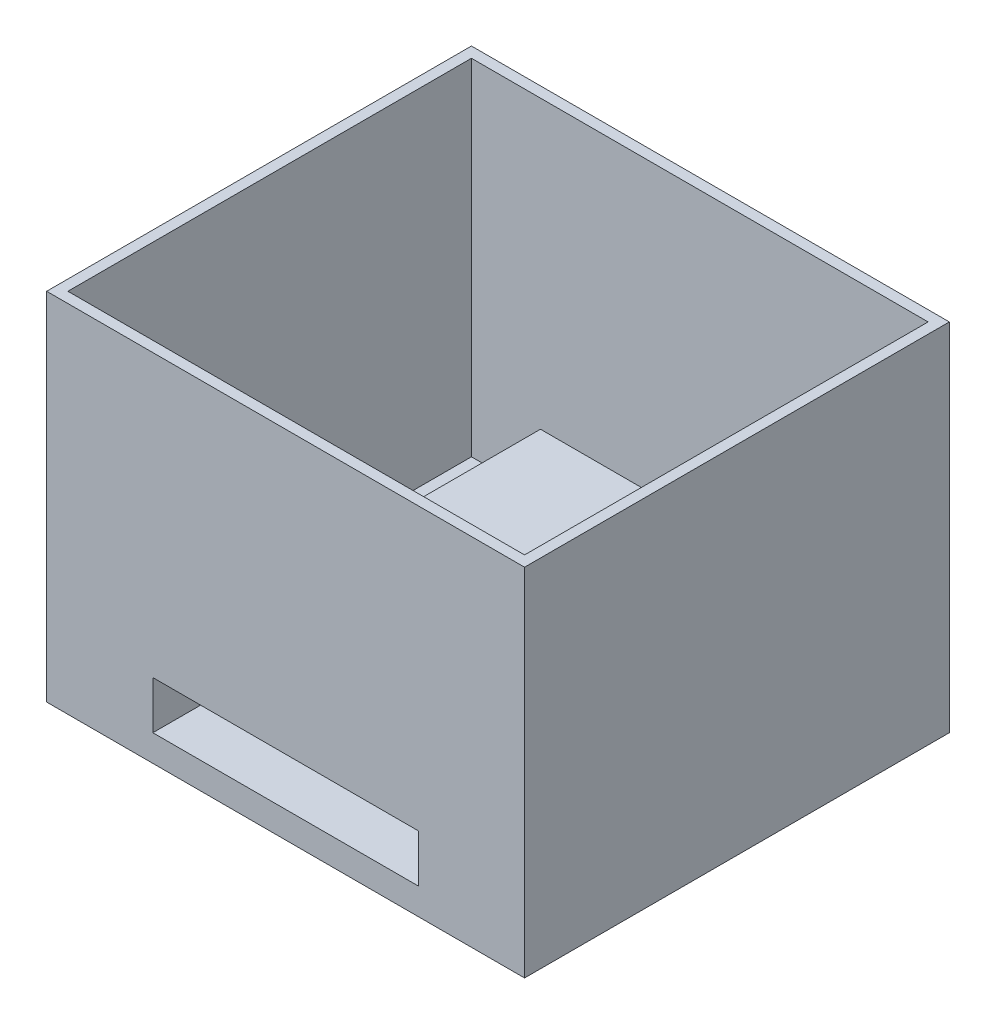
from build123d import *

# Parameters (mm, degrees)
SKETCH1_W           = 90
SKETCH1_H           = 67
BOSS_EXTRUDE1_DEPTH = 40
SHELL1_T            = -2
SKETCH2_W           = 50
SKETCH2_H           = 13
CUT_EXTRUDE4_DEPTH  = 40
SKETCH4_W           = 54
SKETCH4_H           = 13
BOSS_EXTRUDE2_DEPTH = 75
SHELL2_START        = 11.213016769
SHELL2_OUTLINE_W    = 9
SHELL2_OUTLINE_H    = 73
SHELL2_DEPTH        = 50


# Read off the part's stored shape, not the designer's step: Shell2
with BuildPart() as part:
    # Sketch1 → Boss-Extrude1 (new, symmetric)
    with BuildSketch(Plane.XY.offset(58.585622103)):
        with Locations((36.213016769, 11.266964079)):
            Rectangle(SKETCH1_W, SKETCH1_H)
    extrude(amount=BOSS_EXTRUDE1_DEPTH, both=True)

    # Shell1
    shell1_openings = [part.faces().sort_by_distance(p)[0] for p in [
        (36.213016769, 44.766964079, 58.585622103),
    ]]
    offset(amount=SHELL1_T, openings=shell1_openings, kind=Kind.INTERSECTION)

    # Sketch2 → Cut-Extrude4 (cut)
    with BuildSketch(Plane.XY.offset(98.585622103)):
        with Locations((36.213016769, -12.733035921)):
            Rectangle(SKETCH2_W, SKETCH2_H)
    extrude(amount=-CUT_EXTRUDE4_DEPTH, mode=Mode.SUBTRACT)

    # Sketch4 → Boss-Extrude2 (add)
    with BuildSketch(Plane.XY.offset(98.585622103)):
        with Locations((36.213016769, -12.733035921)):
            Rectangle(SKETCH4_W, SKETCH4_H)
    extrude(amount=-BOSS_EXTRUDE2_DEPTH)

    # Shell2 outline → Shell2 (cut)
    with BuildSketch(Plane.YZ.offset(SHELL2_START)):
        with Locations((-12.733035921, 62.085622103)):
            Rectangle(SHELL2_OUTLINE_W, SHELL2_OUTLINE_H)
    extrude(amount=SHELL2_DEPTH, mode=Mode.SUBTRACT)


solid = part.part
